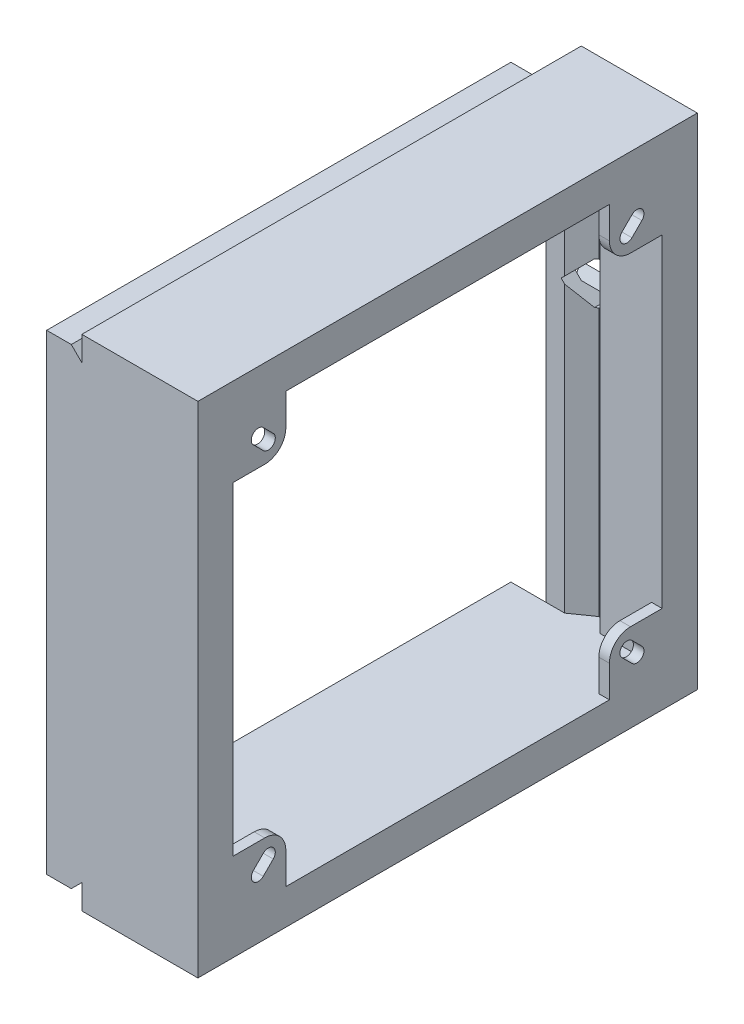
from build123d import *

# Parameters (mm, degrees)
SKETCH2_W           = 142
SKETCH2_H           = 142
SKETCH2_W_2         = 122
SKETCH2_H_2         = 122
BOSS_EXTRUDE1_DEPTH = 3
SKETCH2_4_W         = 142
SKETCH2_4_H         = 142
SKETCH2_4_W_2       = 122
SKETCH2_4_H_2       = 122
BOSS_EXTRUDE2_DEPTH = 30
BOSS_EXTRUDE3_DEPTH = 10
CUT_EXTRUDE5_START  = -132
CUT_EXTRUDE5_DEPTH  = 122
SKETCH15_W          = 122
SKETCH15_H          = 10
BOSS_EXTRUDE4_DEPTH = 10
CAVITY2_START       = -40
CAVITY2_DEPTH       = 10
CAVITY2_START_2     = -61
CAVITY2_2_DEPTH     = 133
CUT_EXTRUDE8_DEPTH  = 25.287407973
CUT_EXTRUDE9_START  = -6
CUT_EXTRUDE9_DEPTH  = 10


with BuildPart() as part:
    # Sketch2 → Boss-Extrude1 (new body)
    # profile 1 of 5: a face of its own
    with BuildSketch(Plane.YZ):
        Rectangle(SKETCH2_W, SKETCH2_H)
        Rectangle(SKETCH2_W_2, SKETCH2_H_2, mode=Mode.SUBTRACT)
    # profile 2 of 5: a face of its own
    with BuildSketch(Plane.YZ):
        with BuildLine():
            Line((-61, 61), (-61, 46))
            Line((-61, 46), (-52, 46))
            ThreePointArc((-52, 46), (-47.757359313, 47.757359313), (-46, 52))
            Line((-46, 52), (-46, 61))
            Line((-46, 61), (-61, 61))
        make_face()
        with BuildLine():
            ThreePointArc((-49.585786438, 52.414213562), (-49.585786438, 49.585786438), (-52.414213562, 49.585786438))
            Line((-52.414213562, 49.585786438), (-55.242640687, 52.414213562))
            ThreePointArc((-55.242640687, 52.414213562), (-55.242640687, 55.242640687), (-52.414213562, 55.242640687))
            Line((-52.414213562, 55.242640687), (-49.585786438, 52.414213562))
        make_face(mode=Mode.SUBTRACT)
    # profile 3 of 5: a face of its own
    with BuildSketch(Plane.YZ):
        with BuildLine():
            Line((52, 46), (61, 46))
            Line((61, 46), (61, 61))
            Line((61, 61), (46, 61))
            Line((46, 61), (46, 52))
            ThreePointArc((46, 52), (47.757359313, 47.757359313), (52, 46))
        make_face()
        with BuildLine():
            ThreePointArc((52.414213562, 49.585786438), (49.585786438, 49.585786438), (49.585786438, 52.414213562))
            Line((49.585786438, 52.414213562), (52.414213562, 55.242640687))
            ThreePointArc((52.414213562, 55.242640687), (55.242640687, 55.242640687), (55.242640687, 52.414213562))
            Line((55.242640687, 52.414213562), (52.414213562, 49.585786438))
        make_face(mode=Mode.SUBTRACT)
    # profile 4 of 5: a face of its own
    with BuildSketch(Plane.YZ):
        with BuildLine():
            Line((46, -52), (46, -61))
            Line((46, -61), (61, -61))
            Line((61, -61), (61, -46))
            Line((61, -46), (52, -46))
            ThreePointArc((52, -46), (47.757359313, -47.757359313), (46, -52))
        make_face()
        with BuildLine():
            ThreePointArc((49.585786438, -52.414213562), (49.585786438, -49.585786438), (52.414213562, -49.585786438))
            Line((52.414213562, -49.585786438), (55.242640687, -52.414213562))
            ThreePointArc((55.242640687, -52.414213562), (55.242640687, -55.242640687), (52.414213562, -55.242640687))
            Line((52.414213562, -55.242640687), (49.585786438, -52.414213562))
        make_face(mode=Mode.SUBTRACT)
    # profile 5 of 5: a face of its own
    with BuildSketch(Plane.YZ):
        with BuildLine():
            Line((-61, -46), (-61, -61))
            Line((-61, -61), (-46, -61))
            Line((-46, -61), (-46, -52))
            ThreePointArc((-46, -52), (-47.757359313, -47.757359313), (-52, -46))
            Line((-52, -46), (-61, -46))
        make_face()
        with BuildLine():
            ThreePointArc((-52.414213562, -49.585786438), (-49.585786438, -49.585786438), (-49.585786438, -52.414213562))
            Line((-49.585786438, -52.414213562), (-52.414213562, -55.242640687))
            ThreePointArc((-52.414213562, -55.242640687), (-55.242640687, -55.242640687), (-55.242640687, -52.414213562))
            Line((-55.242640687, -52.414213562), (-52.414213562, -49.585786438))
        make_face(mode=Mode.SUBTRACT)
    extrude(amount=BOSS_EXTRUDE1_DEPTH)

    # Sketch2<4> → Boss-Extrude2 (add)
    with BuildSketch(Plane.YZ):
        Rectangle(SKETCH2_4_W, SKETCH2_4_H)
        Rectangle(SKETCH2_4_W_2, SKETCH2_4_H_2, mode=Mode.SUBTRACT)
    extrude(amount=-BOSS_EXTRUDE2_DEPTH)

    # Sketch3 → Boss-Extrude3 (add)
    with BuildSketch(Plane(origin=(-30, 0, 0), x_dir=(0, -1, 0), z_dir=(-1, 0, 0))):
        Polygon((-61, -61), (-61, 61), (-61, 71), (-71, 71), (-71, -71), (71, -71), (71, 71), (61, 71), (61, 61), (61, -61), align=None)
    extrude(amount=BOSS_EXTRUDE3_DEPTH)

    # Sketch11 → Cut-Extrude5 (cut)
    with BuildSketch(Plane(origin=(0, 71, 0), x_dir=(-1, 0, 0), z_dir=(0, 1, 0)).offset(CUT_EXTRUDE5_START)):
        Polygon((14.712592027, -65), (19, -65), (24.712592027, -61), (14.712592027, -61), align=None)
    extrude(amount=CUT_EXTRUDE5_DEPTH, mode=Mode.SUBTRACT)

    # Sketch15 → Boss-Extrude4 (add)
    with BuildSketch(Plane(origin=(-30, 0, 0), x_dir=(0, -1, 0), z_dir=(-1, 0, 0))):
        with Locations((0, 66)):
            Rectangle(SKETCH15_W, SKETCH15_H)
    extrude(amount=BOSS_EXTRUDE4_DEPTH)

    # Cavity2: read off the stored shape, not the designer's step
    # Cavity2 outline → Cavity2 (cut)
    with BuildSketch(Plane.YZ.offset(CAVITY2_START)):
        Polygon((19.254896882, -65), (22.745103118, -65), (27, -69.254896882), (24, -71), (71, -71), (71, 71), (67, 71), (67, -61), (-67, -61), (-67, 71), (-71, 71), (-71, -71), (18, -71), (15, -69.254896882), align=None)
    extrude(amount=CAVITY2_DEPTH, mode=Mode.SUBTRACT)

    # Cavity2 2 outline → Cavity2 2 (cut)
    with BuildSketch(Plane.XY.offset(CAVITY2_START_2)):
        Polygon((-30, -67), (-30, -64), (-33, -67), align=None)
        Polygon((-30, 64), (-30, 67), (-33, 67), align=None)
    extrude(amount=CAVITY2_2_DEPTH, mode=Mode.SUBTRACT)

    # Sketch16 → Cut-Extrude8 (cut)
    with BuildSketch(Plane(origin=(-40, 0, 0), x_dir=(0, -1, 0), z_dir=(-1, 0, 0))):
        Polygon((-22.745103118, -65), (-27, -69.254896882), (-24, -71), (-18, -71), (-15, -69.254896882), (-19.254896882, -65), align=None)
    extrude(amount=-CUT_EXTRUDE8_DEPTH, mode=Mode.SUBTRACT)

    # Sketch14 → Cut-Extrude9 (cut)
    with BuildSketch(Plane.XY.offset(-65).offset(CUT_EXTRUDE9_START)):
        Polygon((-19.712592027, 15), (-14.712592027, 15), (-14.712592027, 27), (-19.712592027, 27), (-25.712592027, 21), align=None)
    extrude(amount=CUT_EXTRUDE9_DEPTH, mode=Mode.SUBTRACT)


solid = part.part
